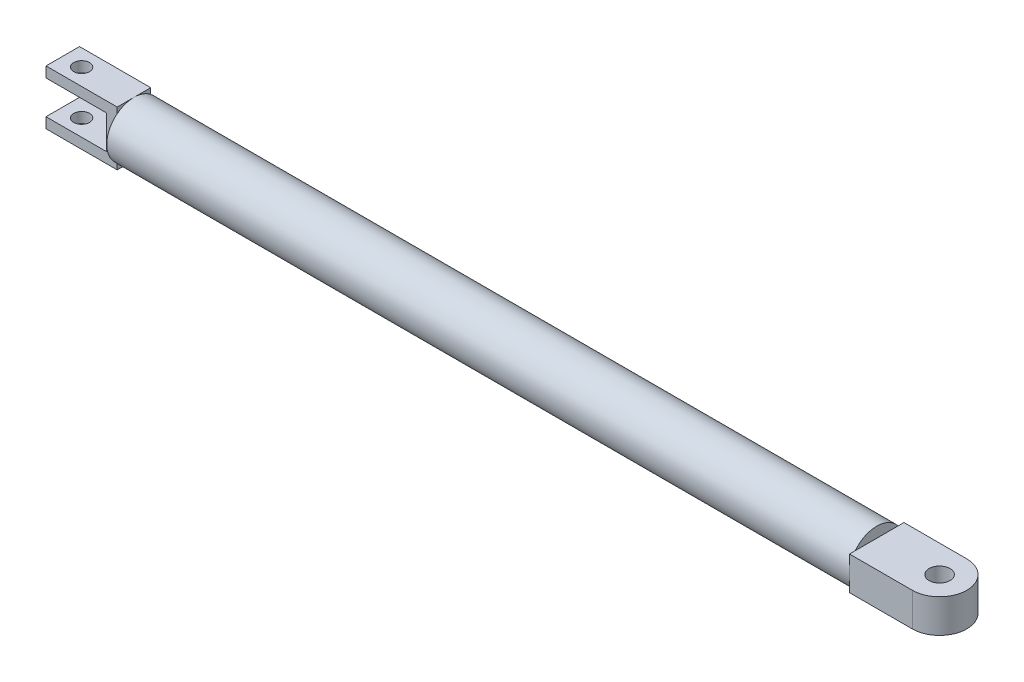
from build123d import *

# Parameters (mm, degrees)
SKETCH1_R                = 8.255
BOSS_EXTRUDE1_DEPTH      = 225.171
BOSS_EXTRUDE2_DEPTH      = 5.08
BOSS_EXTRUDE2_DEPTH_BACK = 5.08
SKETCH2_R                = 3.175
BOSS_EXTRUDE3_DEPTH      = 5.08
BOSS_EXTRUDE3_DEPTH_BACK = 5.08
CUT_EXTRUDE1_DEPTH       = 253.962641167
CUT_EXTRUDE1_DEPTH_BACK  = 253.962641167
SKETCH4_R                = 2.398254968


with BuildPart() as part:
    # Sketch1 → Boss-Extrude1 (new body)
    with BuildSketch(Plane(origin=(0, 0, 0), x_dir=(0, 0, -1), z_dir=(1, 0, 0))):
        Circle(SKETCH1_R)
    extrude(amount=BOSS_EXTRUDE1_DEPTH)

    # Sketch2 → Boss-Extrude2 (add, two sides: drawn at the far end of the back side and taken through both)
    with BuildSketch(Plane(origin=(0, 0, 0), x_dir=(1, 0, 0), z_dir=(0, 1, 0)).offset(-BOSS_EXTRUDE2_DEPTH_BACK)):
        with BuildLine():
            Line((225.171, -8.255), (225.171, 8.255))
            Line((225.171, 8.255), (244.221, 8.255))
            ThreePointArc((244.221, 8.255), (252.476, 0), (244.221, -8.255))
            Line((244.221, -8.255), (225.171, -8.255))
        make_face()
        with Locations((244.221, 0)):
            Circle(SKETCH2_R, mode=Mode.SUBTRACT)
    extrude(amount=BOSS_EXTRUDE2_DEPTH + BOSS_EXTRUDE2_DEPTH_BACK)

    # Sketch3 → Boss-Extrude3 (add, two sides: drawn at the far end of the back side and taken through both)
    with BuildSketch(Plane.XY.offset(-BOSS_EXTRUDE3_DEPTH_BACK)):
        Polygon((0, -8.255), (0, 8.255), (-21.59, 8.255), (-21.59, 5.08), (-3.175, 5.08), (-3.175, -5.08), (-21.59, -5.08), (-21.59, -8.255), align=None)
    extrude(amount=BOSS_EXTRUDE3_DEPTH + BOSS_EXTRUDE3_DEPTH_BACK)

    # Sketch4 → Cut-Extrude1 (cut, two sides: drawn at the far end of the back side and taken through both)
    with BuildSketch(Plane(origin=(0, -5.08, 0), x_dir=(1, 0, 0), z_dir=(0, 1, 0)).offset(-CUT_EXTRUDE1_DEPTH_BACK)):
        with Locations((-15.875, 0)):
            Circle(SKETCH4_R)
    extrude(amount=CUT_EXTRUDE1_DEPTH + CUT_EXTRUDE1_DEPTH_BACK, mode=Mode.SUBTRACT)


solid = part.part
